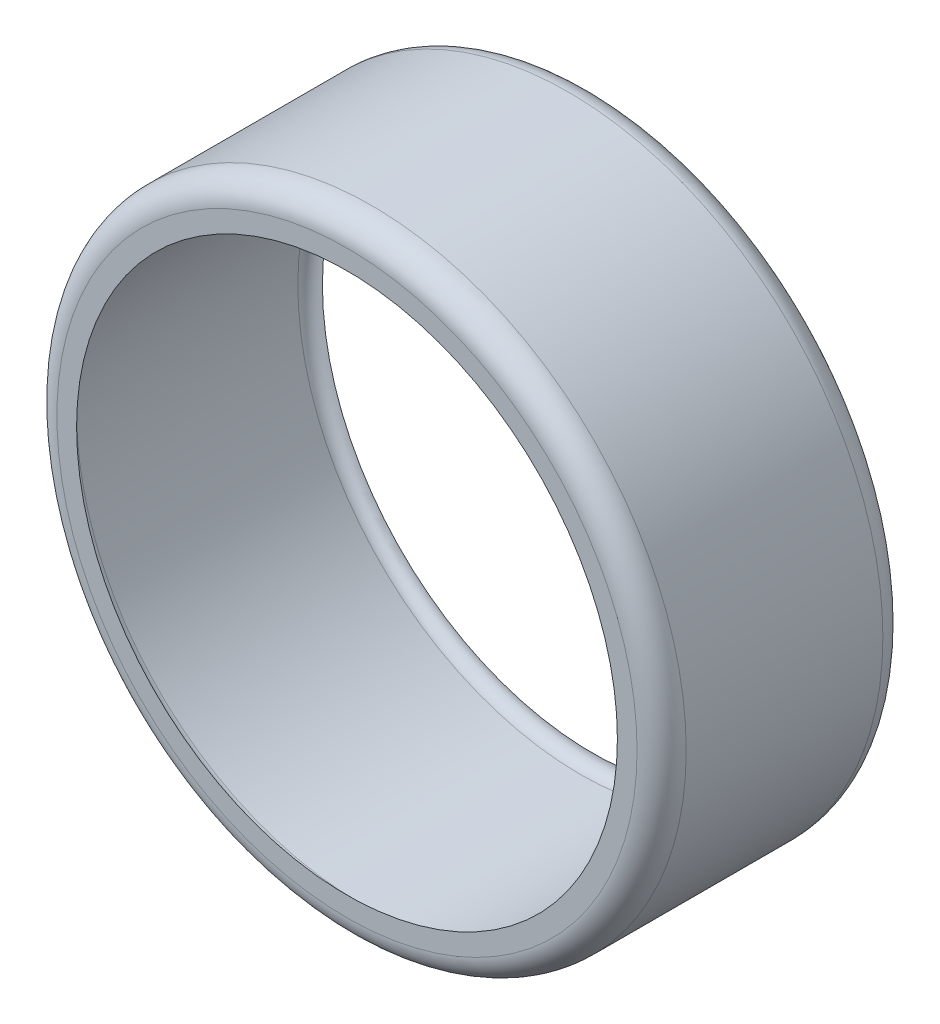
from build123d import *


with BuildPart() as part:
    # Sketch1 → Revolve1 (revolve)
    with BuildSketch(Plane(origin=(0, 0, 0), x_dir=(0, 0, -1), z_dir=(1, 0, 0))):
        with BuildLine():
            Line((0, 27.94), (0, 29.972))
            ThreePointArc((0, 29.972), (0.743948776, 31.768051224), (2.54, 32.512))
            Line((2.54, 32.512), (22.86, 32.512))
            ThreePointArc((22.86, 32.512), (24.656051224, 31.768051224), (25.4, 29.972))
            Line((25.4, 29.972), (25.4, 27.94))
            ThreePointArc((25.4, 27.94), (25.028025612, 28.838025612), (24.13, 29.21))
            Line((24.13, 29.21), (1.27, 29.21))
            ThreePointArc((1.27, 29.21), (0.371974388, 28.838025612), (0, 27.94))
        make_face()
    revolve(axis=Axis((0, 0, 0), (0, 0, -1)))


solid = part.part
